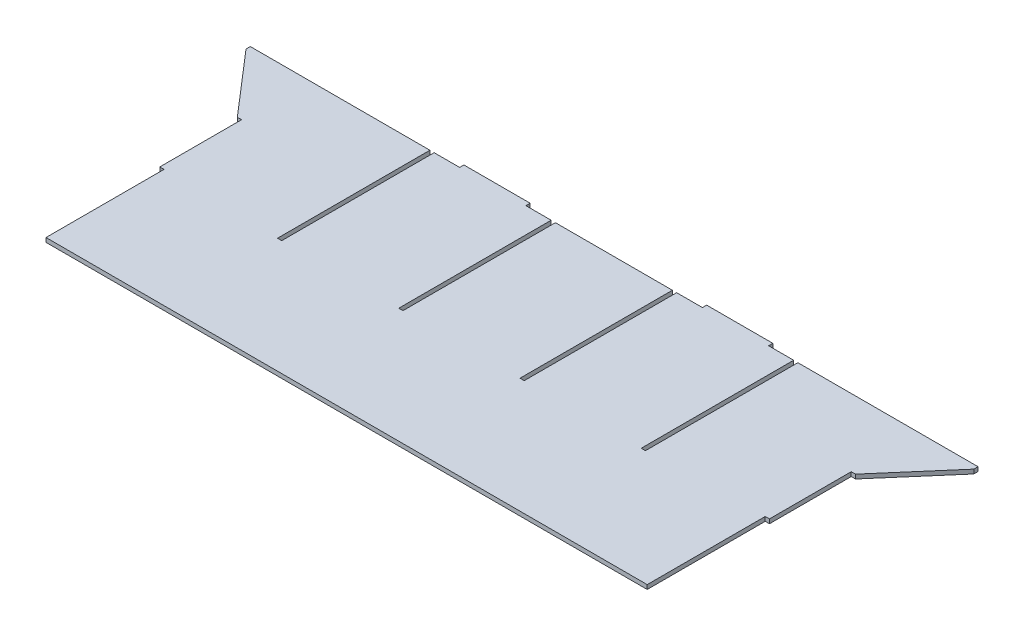
from build123d import *

# Parameters (mm, degrees)
SKETCH1_W           = 457.2230066
SKETCH1_H           = 3.175
BOSS_EXTRUDE1_DEPTH = 200.6419914
SKETCH2_W           = 3.175
SKETCH2_H           = 114.3
CUT_EXTRUDE1_DEPTH  = 305.188278504
LPATTERN1_COUNT     = 4
LPATTERN1_PITCH     = 90.932
BOSS_EXTRUDE3_DEPTH = 3.175
SKETCH5_W           = 3.175
SKETCH5_H           = 88.514
CUT_EXTRUDE2_DEPTH  = 3.175
SKETCH3_W           = 49.658811606
SKETCH3_H           = 3.175
BOSS_EXTRUDE4_DEPTH = 3.18


with BuildPart() as part:
    # Sketch1 → Boss-Extrude1 (new body)
    with BuildSketch(Plane.XY):
        Rectangle(SKETCH1_W, SKETCH1_H)
    extrude(amount=BOSS_EXTRUDE1_DEPTH)

    # Sketch2 → Cut-Extrude1 (cut, through all)
    with BuildSketch(Plane(origin=(0, 1.5875, 0), x_dir=(1, 0, 0), z_dir=(0, 1, 0))):
        with Locations((136.2190033, -57.15)):
            Rectangle(SKETCH2_W, SKETCH2_H)
    cut_extrude1 = extrude(amount=-CUT_EXTRUDE1_DEPTH, mode=Mode.SUBTRACT)

    # LPattern1: Cut-Extrude1 ×4
    with Locations(*[(-i * LPATTERN1_PITCH, 0, 0) for i in range(1, LPATTERN1_COUNT)]):
        add(cut_extrude1, mode=Mode.SUBTRACT)

    # Sketch4 → Boss-Extrude3 (add)
    with BuildSketch(Plane.XZ.offset(1.5875)):
        Polygon((-228.6115033, 0), (-272.8865033, 0), (-272.8865033, 3.175), (-231.7865033, 50.8), (-228.6115033, 50.8), align=None)
    boss_extrude3 = extrude(amount=-BOSS_EXTRUDE3_DEPTH)

    # Mirror1: Boss-Extrude3 across plane
    add(boss_extrude3.mirror(Plane(origin=(0, 0, 0), x_dir=(0, 0, 1), z_dir=(1, 0, 0))))

    # Sketch5 → Cut-Extrude2 (cut)
    with BuildSketch(Plane.XZ.offset(1.5875)):
        with Locations((-227.0240033, 156.3849914)):
            Rectangle(SKETCH5_W, SKETCH5_H)
    cut_extrude2 = extrude(amount=-CUT_EXTRUDE2_DEPTH, mode=Mode.SUBTRACT)

    # Mirror2: Cut-Extrude2 across plane
    add(cut_extrude2.mirror(Plane(origin=(0, 0, 0), x_dir=(0, 0, 1), z_dir=(1, 0, 0))), mode=Mode.SUBTRACT)

    # Sketch3 → Boss-Extrude4 (add)
    with BuildSketch(Plane(origin=(0, 0, 0), x_dir=(-1, 0, 0), z_dir=(0, 0, -1))):
        with Locations((-91.020094169, 0)):
            Rectangle(SKETCH3_W, SKETCH3_H)
        with Locations((91.020094169, 0)):
            Rectangle(SKETCH3_W, SKETCH3_H)
    extrude(amount=BOSS_EXTRUDE4_DEPTH)


solid = part.part
